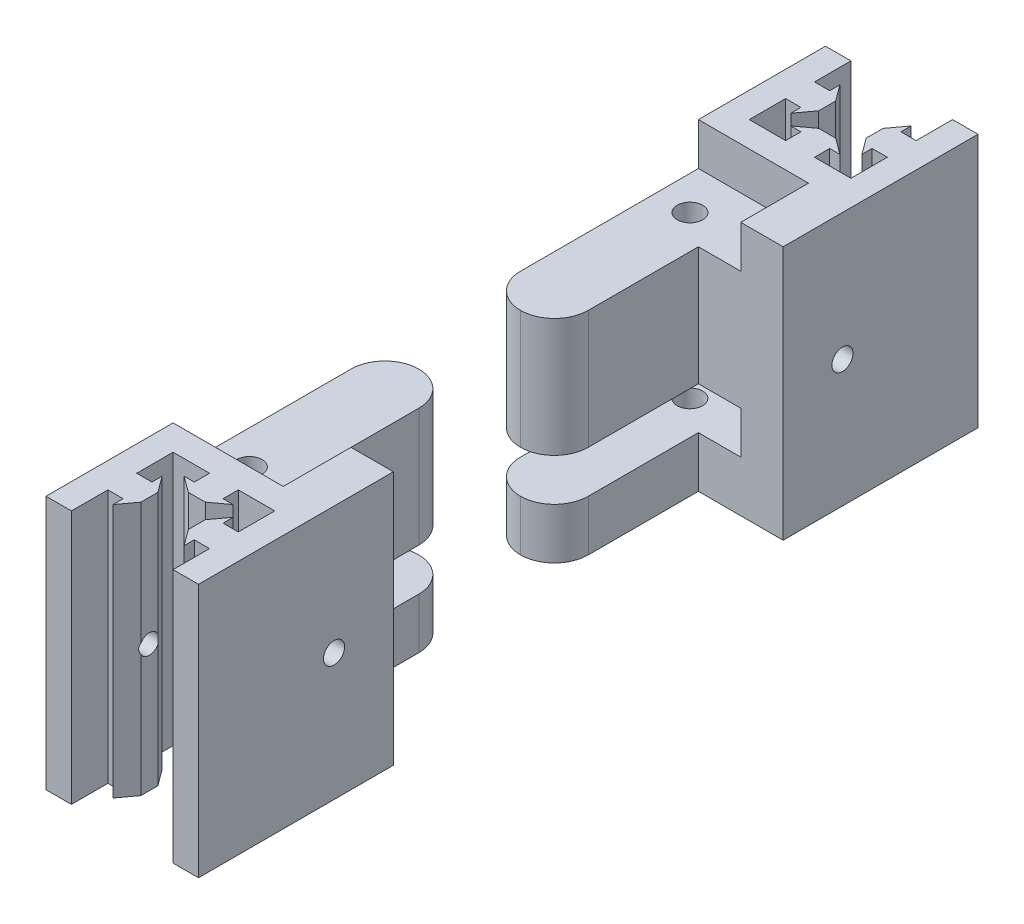
from build123d import *

# Parameters (mm, degrees)
BOSS_EXTRU_6_DEPTH           = 15
R_P_TITION_CIRCULAIRE3_COUNT = 3
R_P_TITION_CIRCULAIRE3_ANGLE = 180
ESQUISSE9_W                  = 18
ESQUISSE9_H                  = 3
ENL_V_MAT_EXTRU_1_DEPTH      = 33.588341474
ESQUISSE10_W                 = 8
ESQUISSE10_H                 = 14
ESQUISSE10_H_2               = 6
BOSS_EXTRU_7_DEPTH           = 25
ESQUISSE12_W                 = 10
ESQUISSE12_H                 = 6
ESQUISSE12_H_2               = 14
BOSS_EXTRU_8_DEPTH           = 8
CONG_1_R                     = 4
ESQUISSE11_R                 = 1.5
ENL_V_MAT_EXTRU_2_DEPTH      = 47.227697325
ESQUISSE13_W                 = 5
ESQUISSE13_H                 = 30
BOSS_EXTRU_9_DEPTH           = 8
ESQUISSE16_R                 = 1.25
ENL_V_MAT_EXTRU_3_DEPTH      = 42.291645644
ENL_V_MAT_EXTRU_4_REACH      = 43.292
ESQUISSE17_R                 = 1.15


with BuildPart() as part:
    # Esquisse8 → Boss.-Extru.6 (new, symmetric)
    with BuildSketch(Plane(origin=(0, 0, 0), x_dir=(1, 0, 0), z_dir=(0, 1, 0))):
        Polygon((-6, 1.7), (-4.2, 1.7), (-4.2, 2.9), (-2.8, 1), (-2.8, -1), (-4.2, -2.9), (-4.2, -1.7), (-6, -1.7), (-6, -9), (-9, -9), (-9, 9), (-6, 9), align=None)
    extrude(amount=BOSS_EXTRU_6_DEPTH, both=True)


with BuildPart() as r_p_tition_circulaire3_1:
    # Répétition circulaire3: pattern copy
    add(part.part.rotate(Axis((0, 0, 0), (0, -1, 0)), 1 * R_P_TITION_CIRCULAIRE3_ANGLE / (R_P_TITION_CIRCULAIRE3_COUNT - 1)))


with BuildPart() as r_p_tition_circulaire3_2:
    # Répétition circulaire3: pattern copy
    add(part.part.rotate(Axis((0, 0, 0), (0, -1, 0)), 2 * R_P_TITION_CIRCULAIRE3_ANGLE / (R_P_TITION_CIRCULAIRE3_COUNT - 1)))


with BuildPart() as enl_v_mat_extru_1_tool:
    # Esquisse9 → Enlèv. mat.-Extru.1 (new, through all)
    with BuildSketch(Plane(origin=(0, 15, 0), x_dir=(1, 0, 0), z_dir=(0, 1, 0))):
        with Locations((0, -7.5)):
            Rectangle(ESQUISSE9_W, ESQUISSE9_H)
    extrude(amount=-ENL_V_MAT_EXTRU_1_DEPTH)


with BuildPart() as part_1:
    add(part.part)

    # Enlèv. mat.-Extru.1: cut by enl_v_mat_extru_1_tool
    add(enl_v_mat_extru_1_tool.part, mode=Mode.SUBTRACT)


    add(r_p_tition_circulaire3_1.part)  # Boss.-Extru.7 merges Répétition circulaire3_1
    # Esquisse10 → Boss.-Extru.7 (add)
    with BuildSketch(Plane(origin=(0, 0, -9), x_dir=(-1, 0, 0), z_dir=(0, 0, -1))):
        with Locations((5, 3)):
            Rectangle(ESQUISSE10_W, ESQUISSE10_H)
        with Locations((5, -12)):
            Rectangle(ESQUISSE10_W, ESQUISSE10_H_2)
    extrude(amount=BOSS_EXTRU_7_DEPTH)



with BuildPart() as r_p_tition_circulaire3_2_1:
    add(r_p_tition_circulaire3_2.part)

    # Enlèv. mat.-Extru.1: cut by enl_v_mat_extru_1_tool
    add(enl_v_mat_extru_1_tool.part, mode=Mode.SUBTRACT)


with BuildPart() as part_2:
    add(part_1.part)

    add(r_p_tition_circulaire3_2_1.part)  # Boss.-Extru.8 merges Répétition circulaire3_2
    # Esquisse12 → Boss.-Extru.8 (add)
    with BuildSketch(Plane(origin=(0, 0, -9), x_dir=(-1, 0, 0), z_dir=(0, 0, -1))):
        with Locations((-4, -12)):
            Rectangle(ESQUISSE12_W, ESQUISSE12_H)
        with Locations((-4, 3)):
            Rectangle(ESQUISSE12_W, ESQUISSE12_H_2)
    extrude(amount=BOSS_EXTRU_8_DEPTH)

    # Congé1
    cong_1_edges = [part_2.edges().sort_by_distance(p)[0] for p in [
        (-9, 3, -34),
        (-1, -12, -34),
        (-9, -12, -34),
        (-1, 3, -34),
    ]]
    fillet(cong_1_edges, radius=CONG_1_R - 0.0001)  # a hair under: the kernel refuses the full size

    # Esquisse11 → Enlèv. mat.-Extru.2 (cut, through all)
    with BuildSketch(Plane(origin=(0, 15, 0), x_dir=(1, 0, 0), z_dir=(0, 1, 0))):
        with Locations(Location((-5, 14, 0), (0, 0, 180))):
            Circle(ESQUISSE11_R)
    extrude(amount=-ENL_V_MAT_EXTRU_2_DEPTH, mode=Mode.SUBTRACT)

    # Esquisse13 → Boss.-Extru.9 (add)
    with BuildSketch(Plane(origin=(0, 0, -9), x_dir=(-1, 0, 0), z_dir=(0, 0, -1))):
        with Locations((-6.5, 0)):
            Rectangle(ESQUISSE13_W, ESQUISSE13_H)
    extrude(amount=BOSS_EXTRU_9_DEPTH)

    # Esquisse16 → Enlèv. mat.-Extru.3 (cut, through all)
    with BuildSketch(Plane(origin=(9, 0, 0), x_dir=(0, 0, -1), z_dir=(1, 0, 0))):
        with Locations((10, 0)):
            Circle(ESQUISSE16_R)
    extrude(amount=-ENL_V_MAT_EXTRU_3_DEPTH, mode=Mode.SUBTRACT)

    # Esquisse17 → Enlèv. mat.-Extru.4 (cut, up to next)
    with BuildSketch(Plane.ZY.offset(9), mode=Mode.PRIVATE) as enl_v_mat_extru_4_sk1:
        Circle(ESQUISSE17_R)
    enl_v_mat_extru_4_tool1 = extrude(enl_v_mat_extru_4_sk1.sketch, amount=-ENL_V_MAT_EXTRU_4_REACH, mode=Mode.PRIVATE) & part_2.part
    add(enl_v_mat_extru_4_tool1.solids().sort_by_distance((-9, 0, 0))[0], mode=Mode.SUBTRACT)


with BuildPart() as body_2:
    # Symétrie2: mirrored copy
    add(part_2.part.mirror(Plane.XY.offset(-40)))


solid = Compound([part_2.part, body_2.part])
